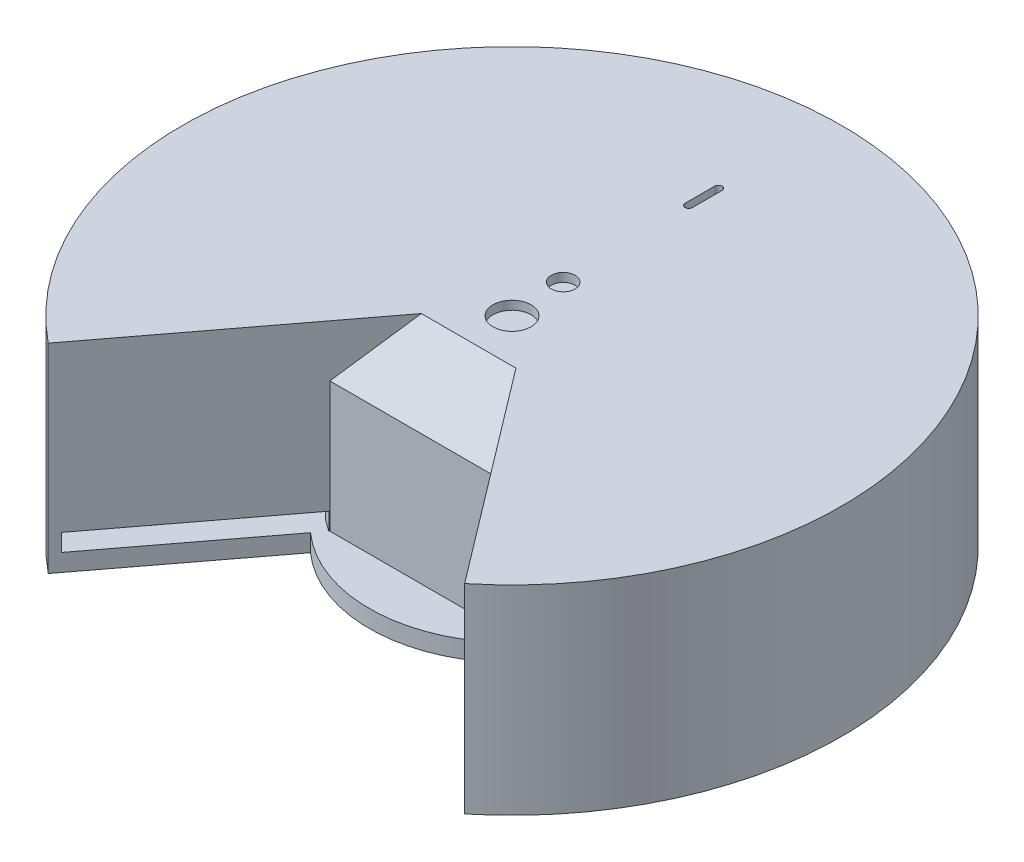
from build123d import *

# Parameters (mm, degrees)
SKETCH_1_R                = 190
EXTRUDE_1_DEPTH           = 10
SKETCH_2_R                = 11
CUT_EXTRUDE_1_DEPTH       = 10
CUT_EXTRUDE_2_DEPTH       = 10
CUT_EXTRUDE_3_DEPTH       = 10
SKETCH_5_R                = 11.5
CUT_EXTRUDE_4_DEPTH       = 2
SKETCH_6_R                = 3
CUT_EXTRUDE_5_DEPTH       = 22
SKETCH_7_R                = 2
CUT_EXTRUDE_6_DEPTH       = 20
PATTERN_CIRCULAR_1_COUNT  = 4
EXTRUDE_2_DEPTH           = 100
EXTRUDE_3_DEPTH           = 5
CUT_EXTRUDE_START         = -5
SKETCH_11_R               = 11
CUT_EXTRUDE_7_DEPTH       = 5
SKETCH_12_W               = 100
SKETCH_12_H               = 115
EXTRUDE_4_DEPTH           = 5
EXTRUDE_5_DEPTH           = 115
CUT_EXTRUDE_8_DEPTH       = 289.487434735
SKETCH_15_W               = 110
SKETCH_15_H               = 10
CUT_EXTRUDE_9_DEPTH       = 23
SKETCH_16_W               = 110
SKETCH_16_H               = 10
CUT_EXTRUDE_10_DEPTH      = 23
EXTRUDE_6_DEPTH           = 10
SKETCH_18_R               = 10
EXTRUDE_7_DEPTH           = 100
SKETCH_20_W               = 40.15762627
SKETCH_20_H               = 37.957208392
EXTRUDE_8_DEPTH           = 20
CUT_EXTRUDE_11_DEPTH      = 70
SKETCH_22_W               = 6
SKETCH_22_H               = 39.800206828
SKETCH_24_R               = 10.715541735
EXTRUDE_9_DEPTH           = 50
SKETCH_25_R               = 8.111462828
CUT_EXTRUDE_13_DEPTH      = 1
FILLET_2_R                = 3
SKETCH_26_W               = 20.914862296
SKETCH_26_H               = 66.390296829
CUT_EXTRUDE_14_DEPTH      = 41
EXTRUDE_START             = -5
EXTRUDE_10_DEPTH          = 5
CUT_EXTRUDE_15_DEPTH      = 369.496652909
CUT_EXTRUDE_15_DEPTH_BACK = 369.496652909
SKETCH_28_W               = 81.996426071
SKETCH_28_H               = 91.436240801
EXTRUDE_11_DEPTH          = 142
SKETCH_30_W               = 61.807944975
SKETCH_30_H               = 65.134221846
EXTRUDE_12_DEPTH          = 5
FILLET_4_R                = 13
SKETCH_31_W               = 61.807944975
SKETCH_31_H               = 147
EXTRUDE_13_DEPTH          = 70
SKETCH_32_W               = 51.807944975
SKETCH_32_H               = 142
CUT_EXTRUDE_16_DEPTH      = 60
FILLET_5_R                = 13
FILLET_6_R                = 13
CUT_EXTRUDE_17_DEPTH      = 60
CUT_EXTRUDE_18_DEPTH      = 60
EXTRUDE_START_2           = -75
SKETCH_35_W               = 61.807944975
SKETCH_35_H               = 6.562212177
EXTRUDE_14_DEPTH          = 75
CUT_EXTRUDE_19_DEPTH      = 60
CUT_EXTRUDE_START_2       = 70
CUT_EXTRUDE_20_DEPTH      = 70
SKETCH_40_R               = 6.852948308
CUT_EXTRUDE_24_DEPTH      = 10
CHAMFER_1_SIZE            = 30
CHAMFER_2_SIZE            = 30
CUT_EXTRUDE_25_DEPTH      = 216


# Read off the part's stored shape, not the designer's step: 圆顶1
with BuildPart() as part:
    # 草图1 → 凸台-拉伸1 (new body)
    with BuildSketch(Plane(origin=(0, 0, 0), x_dir=(1, 0, 0), z_dir=(0, 1, 0))):
        with Locations(Location((0, 0, 0), (0, 0, 270))):
            Circle(SKETCH_1_R)
    extrude(amount=EXTRUDE_1_DEPTH)

    # 草图2 → 切除-拉伸1 (cut)
    with BuildSketch(Plane(origin=(0, 10, 0), x_dir=(1, 0, 0), z_dir=(0, 1, 0))):
        with Locations(Location((0, 0, 0), (0, 0, 270))):
            Circle(SKETCH_2_R)
    extrude(amount=-CUT_EXTRUDE_1_DEPTH, mode=Mode.SUBTRACT)

    # 草图3 → 切除-拉伸2 (cut)
    with BuildSketch(Plane(origin=(0, 10, 0), x_dir=(1, 0, 0), z_dir=(0, 1, 0))):
        Polygon((-50, -50), (-120, -147.309198627), (120, -147.309198627), (50, -50), align=None)
    extrude(amount=-CUT_EXTRUDE_2_DEPTH, mode=Mode.SUBTRACT)

    # 草图4 → 切除-拉伸3 (cut)
    with BuildSketch(Plane(origin=(0, 10, 0), x_dir=(1, 0, 0), z_dir=(0, 1, 0))):
        Polygon((50, -50), (136.06201209, -169.637506124), (-54.476164161, -215.928987862), (-150.534220248, -169.637506124), (-120, -147.309198627), (-80.889727825, -92.940780863), align=None)
    extrude(amount=-CUT_EXTRUDE_3_DEPTH, mode=Mode.SUBTRACT)

    # 草图5 → 切除-拉伸4 (cut)
    with BuildSketch(Plane(origin=(0, 10, 0), x_dir=(1, 0, 0), z_dir=(0, 1, 0))):
        with Locations(Location((0, 31.5, 0), (0, 0, 270))):
            Circle(SKETCH_5_R)
    extrude(amount=-CUT_EXTRUDE_4_DEPTH, mode=Mode.SUBTRACT)

    # 草图6 → 切除-拉伸5 (cut)
    with BuildSketch(Plane(origin=(0, 8, 0), x_dir=(1, 0, 0), z_dir=(0, 1, 0))):
        with Locations(Location((0, 31.5, 0), (0, 0, 270))):
            Circle(SKETCH_6_R)
    extrude(amount=-CUT_EXTRUDE_5_DEPTH, mode=Mode.SUBTRACT)

    # 草图7 → 切除-拉伸6 (cut)
    with BuildSketch(Plane(origin=(0, 10, 0), x_dir=(1, 0, 0), z_dir=(0, 1, 0))):
        with Locations(Location((15.706904535, 45.738439167, 0), (0, 0, 270))):
            Circle(SKETCH_7_R)
    cut_extrude_6 = extrude(amount=-CUT_EXTRUDE_6_DEPTH, mode=Mode.SUBTRACT)

    # 阵列(圆周)1: 切除-拉伸6 ×4 about axis
    pattern_circular_1_axis = Axis((0, 0, -31.5), (0, 1, 0))
    for i in range(1, PATTERN_CIRCULAR_1_COUNT):
        add(cut_extrude_6.rotate(pattern_circular_1_axis, i * 360 / PATTERN_CIRCULAR_1_COUNT), mode=Mode.SUBTRACT)

    # 草图9 → 凸台-拉伸2 (add)
    with BuildSketch(Plane(origin=(0, 10, 0), x_dir=(1, 0, 0), z_dir=(0, 1, 0))):
        with BuildLine():
            Line((50, -50), (120, -147.309198627))
            ThreePointArc((120, -147.309198627), (0, 190), (-120, -147.309198627))
            Line((-120, -147.309198627), (-50, -50))
            Line((-50, -50), (50, -50))
        make_face()
        with BuildLine():
            Line((52.56250687, -45), (120.913822869, -140.017311213))
            ThreePointArc((120.913822869, -140.017311213), (0, 185), (-120.913822869, -140.017311213))
            Line((-120.913822869, -140.017311213), (-52.56250687, -45))
            Line((-52.56250687, -45), (52.56250687, -45))
        make_face(mode=Mode.SUBTRACT)
    extrude(amount=EXTRUDE_2_DEPTH)

    # 草图10 → 凸台-拉伸3 (add)
    with BuildSketch(Plane(origin=(0, 110, 0), x_dir=(1, 0, 0), z_dir=(0, 1, 0))):
        with BuildLine():
            Line((-50, -50), (50, -50))
            Line((50, -50), (120, -147.309198627))
            ThreePointArc((120, -147.309198627), (0, 190), (-120, -147.309198627))
            Line((-120, -147.309198627), (-50, -50))
        make_face()
    extrude(amount=EXTRUDE_3_DEPTH)

    # 草图11 → 切除-拉伸7 (cut)
    with BuildSketch(Plane.XZ.offset(-110).offset(CUT_EXTRUDE_START)):
        with Locations(Location((0, 0, 0), (0, 0, 90))):
            Circle(SKETCH_11_R)
    extrude(amount=CUT_EXTRUDE_7_DEPTH, mode=Mode.SUBTRACT)

    # 草图12 → 凸台-拉伸4 (add)
    with BuildSketch(Plane.XY.offset(50)):
        with Locations((0, 57.5)):
            Rectangle(SKETCH_12_W, SKETCH_12_H)
    extrude(amount=EXTRUDE_4_DEPTH)

    # 草图13 → 凸台-拉伸5 (add)
    with BuildSketch(Plane.XZ):
        Polygon((-120, 147.309198627), (-50, 55), (-50, 50), align=None)
        Polygon((50, 50), (120, 147.309198627), (50, 55), align=None)
    extrude(amount=-EXTRUDE_5_DEPTH)

    # 草图14 → 切除-拉伸8 (cut, through all)
    with BuildSketch(Plane(origin=(0, 10, 0), x_dir=(1, 0, 0), z_dir=(0, 1, 0))):
        with BuildLine():
            Line((-175, 60), (175, 60))
            ThreePointArc((175, 60), (0, 185), (-175, 60))
        make_face()
    extrude(amount=CUT_EXTRUDE_8_DEPTH, mode=Mode.SUBTRACT)

    # 草图15 → 切除-拉伸9 (cut)
    with BuildSketch(Plane(origin=(-13.305974514, 0, -9.571738635), x_dir=(-0.5839606140594331, 0, 0.8117819911942675), z_dir=(-0.8117819911942675, 0, -0.5839606140594331))):
        with Locations((129.272441949, 15)):
            Rectangle(SKETCH_15_W, SKETCH_15_H)
    extrude(amount=-CUT_EXTRUDE_9_DEPTH, mode=Mode.SUBTRACT)

    # 草图16 → 切除-拉伸10 (cut)
    with BuildSketch(Plane(origin=(13.305974514, 0, -9.571738635), x_dir=(-0.5839606140594333, 0, -0.8117819911942674), z_dir=(0.8117819911942673, 0, -0.5839606140594332))):
        with Locations((-129.272441949, 15)):
            Rectangle(SKETCH_16_W, SKETCH_16_H)
    extrude(amount=-CUT_EXTRUDE_10_DEPTH, mode=Mode.SUBTRACT)

    # 草图17 → 凸台-拉伸6 (add)
    with BuildSketch(Plane.XZ):
        with BuildLine():
            Line((-68.721971502, 45.192401274), (70.16486598, 42.91799252))
            ThreePointArc((70.16486598, 42.91799252), (1.34674419, 82.238973608), (-68.721971502, 45.192401274))
        make_face()
    extrude(amount=-EXTRUDE_6_DEPTH)

    # 草图18 → 凸台-拉伸7 (add)
    with BuildSketch(Plane(origin=(0, 115, 0), x_dir=(1, 0, 0), z_dir=(0, 1, 0))):
        with Locations(Location((0, 46.854928923, 0), (0, 0, 90))):
            Circle(SKETCH_18_R)
    extrude(amount=EXTRUDE_7_DEPTH)

    # 草图20 → 凸台-拉伸8 (add)
    with BuildSketch(Plane(origin=(0, 215, 0), x_dir=(1, 0, 0), z_dir=(0, 1, 0))):
        with Locations((-0.847426087, 46.622471939)):
            Rectangle(SKETCH_20_W, SKETCH_20_H)
    extrude(amount=EXTRUDE_8_DEPTH)

    # 草图21 → 切除-拉伸11 (cut)
    with BuildSketch(Plane.ZY.offset(20.926239222)):
        Polygon((-54.791741718, 236.72389037), (-19.944006341, 217.982251176), (-19.065492004, 240.530785832), align=None)
    extrude(amount=-CUT_EXTRUDE_11_DEPTH, mode=Mode.SUBTRACT)

    # 草图22 → 旋转1 (revolve)
    with BuildSketch(Plane(origin=(0, 160.757687824, 86.457916141), x_dir=(1, 0, 0), z_dir=(0, 0.8807086333026608, 0.4736584246333635)), mode=Mode.PRIVATE) as revolve_1_sk:
        with Locations((1.240539722, 142.968257651)):
            Rectangle(SKETCH_22_W, SKETCH_22_H)
    revolve(revolve_1_sk.sketch.rotate(Axis((-1.759460278, 237.901659149, -56.981655541), (0, -0.47365842463336366, 0.8807086333026606)), 90), axis=Axis((-1.759460278, 237.901659149, -56.981655541), (0, -0.47365842463336366, 0.8807086333026606)))

    # 草图24 → 凸台-拉伸9 (add)
    with BuildSketch(Plane(origin=(0, 58.292268059, -108.387185922), x_dir=(1, 0, 0), z_dir=(0, -0.4736584246333635, 0.8807086333026606))):
        with Locations(Location((-1.759460278, 182.532203893, 0), (0, 0, 270))):
            Circle(SKETCH_24_R)
    extrude(amount=-EXTRUDE_9_DEPTH)

    # 草图25 → 切除-拉伸13 (cut)
    with BuildSketch(Plane(origin=(0, 58.292268059, -108.387185922), x_dir=(1, 0, 0), z_dir=(0, -0.4736584246333635, 0.8807086333026606))):
        with Locations(Location((-1.759460278, 182.532203893, 0), (0, 0, 270))):
            Circle(SKETCH_25_R)
    extrude(amount=-CUT_EXTRUDE_13_DEPTH, mode=Mode.SUBTRACT)

    # 圆角2
    fillet_2_edges = [part.edges().sort_by_distance(p)[0] for p in [
        (0, 115, -36.854928923),
    ]]
    fillet(fillet_2_edges, radius=FILLET_2_R)

    # 草图26 → 切除-拉伸14 (cut)
    with BuildSketch(Plane(origin=(0, 160.757687824, 86.457916141), x_dir=(1, 0, 0), z_dir=(0, 0.8807086333026608, 0.4736584246333635))):
        with Locations((27.855490238, 146.001600843)):
            Rectangle(SKETCH_26_W, SKETCH_26_H)
    extrude(amount=-CUT_EXTRUDE_14_DEPTH, mode=Mode.SUBTRACT)

    # 草图27 → 凸台-拉伸10 (add)
    with BuildSketch(Plane(origin=(0, 115, 0), x_dir=(1, 0, 0), z_dir=(0, 1, 0)).offset(EXTRUDE_START)):
        with BuildLine():
            Line((-175, 60), (175, 60))
            ThreePointArc((175, 60), (0, 185), (-175, 60))
        make_face()
    extrude(amount=EXTRUDE_10_DEPTH)

    # 草图28 → 切除-拉伸15 (cut, two sides: drawn at the far end of the back side and taken through both)
    with BuildSketch(Plane(origin=(0, 0, 0), x_dir=(0, 0, -1), z_dir=(1, 0, 0)).offset(-CUT_EXTRUDE_15_DEPTH_BACK)):
        with Locations((192.841193776, 59.465903433)):
            Rectangle(SKETCH_28_W, SKETCH_28_H)
    extrude(amount=CUT_EXTRUDE_15_DEPTH + CUT_EXTRUDE_15_DEPTH_BACK, mode=Mode.SUBTRACT)

    # 草图29 → 凸台-拉伸11 (add)
    with BuildSketch(Plane(origin=(0, 115, 0), x_dir=(1, 0, 0), z_dir=(0, 1, 0))):
        Polygon((-32.985541705, 83.704196909), (-32.985541705, 18.569975063), (-27.985541705, 18.569975063), (-27.985541705, 78.704196909), (23.82240327, 78.704196909), (23.82240327, 18.569975063), (28.82240327, 18.569975063), (28.82240327, 83.704196909), align=None)
    extrude(amount=EXTRUDE_11_DEPTH)

    # 草图30 → 凸台-拉伸12 (add)
    with BuildSketch(Plane(origin=(0, 257, 0), x_dir=(1, 0, 0), z_dir=(0, 1, 0))):
        with Locations((-2.081569218, 51.137085986)):
            Rectangle(SKETCH_30_W, SKETCH_30_H)
    extrude(amount=EXTRUDE_12_DEPTH)

    # 圆角4
    fillet_4_edges = [part.edges().sort_by_distance(p)[0] for p in [
        (-27.985541705, 257, -48.637085986),
        (23.82240327, 257, -48.637085986),
    ]]
    fillet(fillet_4_edges, radius=FILLET_4_R)

    # 草图31 → 凸台-拉伸13 (add)
    with BuildSketch(Plane(origin=(0, 0, -83.704196909), x_dir=(-1, 0, 0), z_dir=(0, 0, -1))):
        with Locations((2.081569218, 188.5)):
            Rectangle(SKETCH_31_W, SKETCH_31_H)
    extrude(amount=EXTRUDE_13_DEPTH)

    # 草图32 → 切除-拉伸16 (cut)
    with BuildSketch(Plane(origin=(0, 0, -153.704196909), x_dir=(-1, 0, 0), z_dir=(0, 0, -1))):
        with Locations((2.081569218, 186)):
            Rectangle(SKETCH_32_W, SKETCH_32_H)
    extrude(amount=-CUT_EXTRUDE_16_DEPTH, mode=Mode.SUBTRACT)

    # 圆角5
    fillet_5_edges = [part.edges().sort_by_distance(p)[0] for p in [
        (-32.985541705, 262, -86.137085986),
        (28.82240327, 262, -86.137085986),
    ]]
    fillet(fillet_5_edges, radius=FILLET_5_R)

    # 圆角6
    fillet_6_edges = [part.edges().sort_by_distance(p)[0] for p in [
        (23.82240327, 257, -123.704196909),
        (-27.985541705, 257, -123.704196909),
    ]]
    fillet(fillet_6_edges, radius=FILLET_6_R)

    # 草图33 → 切除-拉伸17 (cut)
    with BuildSketch(Plane.XY.offset(-78.704196909)):
        with BuildLine():
            Line((13.892318938, 199.249147057), (13.892318938, 143.139086494))
            ThreePointArc((13.892318938, 143.139086494), (0, 129.246767556), (-13.892318938, 143.139086494))
            Line((-13.892318938, 143.139086494), (-13.892318938, 199.249147057))
            ThreePointArc((-13.892318938, 199.249147057), (0, 213.141465996), (13.892318938, 199.249147057))
        make_face()
    extrude(amount=-CUT_EXTRUDE_17_DEPTH, mode=Mode.SUBTRACT)

    # 草图34 → 切除-拉伸18 (cut)
    with BuildSketch(Plane(origin=(0, 115, 0), x_dir=(1, 0, 0), z_dir=(0, 1, 0))):
        with BuildLine():
            Line((-6.290976551, 106.02597296), (-6.290976551, 123.135910488))
            ThreePointArc((-6.290976551, 123.135910488), (-4.165768662, 125.261118376), (-2.040560774, 123.135910488))
            Line((-2.040560774, 123.135910488), (-2.040560774, 106.02597296))
            ThreePointArc((-2.040560774, 106.02597296), (-4.165768662, 103.900765071), (-6.290976551, 106.02597296))
        make_face()
    extrude(amount=-CUT_EXTRUDE_18_DEPTH, mode=Mode.SUBTRACT)

    # 草图35 → 凸台-拉伸14 (add)
    with BuildSketch(Plane(origin=(0, 0, -153.704196909), x_dir=(-1, 0, 0), z_dir=(0, 0, -1)).offset(EXTRUDE_START_2)):
        with Locations((2.081569218, 185.281106088)):
            Rectangle(SKETCH_35_W, SKETCH_35_H)
    extrude(amount=EXTRUDE_14_DEPTH)

    # 草图36 → 切除-拉伸19 (cut)
    with BuildSketch(Plane(origin=(0, 188.562212177, 0), x_dir=(1, 0, 0), z_dir=(0, 1, 0))):
        with BuildLine():
            Line((-6.290976551, 123.135910488), (-6.290976551, 106.02597296))
            ThreePointArc((-6.290976551, 106.02597296), (-4.165768662, 103.900765071), (-2.040560774, 106.02597296))
            Line((-2.040560774, 106.02597296), (-2.040560774, 123.135910488))
            ThreePointArc((-2.040560774, 123.135910488), (-4.165768662, 125.261118376), (-6.290976551, 123.135910488))
        make_face()
    extrude(amount=-CUT_EXTRUDE_19_DEPTH, mode=Mode.SUBTRACT)

    # 圆顶1 outline → 圆顶1 (revolve)
    with BuildSketch(Plane(origin=(-1.759460278, 160.757687824, 86.457916141), x_dir=(1, 0, 0), z_dir=(0, 0.880708633302661, 0.473658424633363))):
        with BuildLine():
            Line((0, 124.068154246), (0, 119.068154237))
            ThreePointArc((0, 119.068154237), (4.764342278, 120.41858011), (8.111462832, 124.068154246))
            Line((8.111462832, 124.068154246), (0, 124.068154246))
        make_face()
    revolve(axis=Axis((-1.759460278, 160.757687824, 86.457916141), (0, 0.473658424633363, -0.880708633302661)))

    # 草图37 → 切除-拉伸20 (cut)
    with BuildSketch(Plane.XY.offset(-78.704196909).offset(CUT_EXTRUDE_START_2)):
        with BuildLine():
            Line((-27.985541705, 115), (23.82240327, 115))
            Line((23.82240327, 115), (23.82240327, 244))
            ThreePointArc((23.82240327, 244), (20.014791425, 253.192388155), (10.82240327, 257))
            Line((10.82240327, 257), (-14.985541705, 257))
            ThreePointArc((-14.985541705, 257), (-24.177929861, 253.192388155), (-27.985541705, 244))
            Line((-27.985541705, 244), (-27.985541705, 115))
        make_face()
    extrude(amount=-CUT_EXTRUDE_20_DEPTH, mode=Mode.SUBTRACT)

    # 草图40 → 切除-拉伸24 (cut)
    with BuildSketch(Plane(origin=(0, 115, 0), x_dir=(1, 0, 0), z_dir=(0, 1, 0))):
        with Locations(Location((-2.06616942, 31.55452141, 0), (0, 0, 270))):
            Circle(SKETCH_40_R)
    extrude(amount=-CUT_EXTRUDE_24_DEPTH, mode=Mode.SUBTRACT)

    # 倒角1
    chamfer_1_edges = [part.edges().sort_by_distance(p)[0] for p in [
        (0, 115, 55),
    ]]
    chamfer(chamfer_1_edges, length=CHAMFER_1_SIZE)

    # 倒角2
    chamfer_2_edges = [part.edges().sort_by_distance(p)[0] for p in [
        (0, 110, 45),
    ]]
    chamfer(chamfer_2_edges, length=CHAMFER_2_SIZE)

    # 草图41 → 切除-拉伸25 (cut)
    with BuildSketch(Plane(origin=(0, 115, 0), x_dir=(1, 0, 0), z_dir=(0, 1, 0))):
        with BuildLine():
            Line((-120, -147.309198627), (-27.250371239, -25))
            Line((-27.250371239, -25), (27.250371239, -25))
            Line((27.250371239, -25), (120, -147.309198627))
            ThreePointArc((120, -147.309198627), (0, 190), (-120, -147.309198627))
        make_face()
    extrude(amount=CUT_EXTRUDE_25_DEPTH, mode=Mode.SUBTRACT)


solid = part.part
